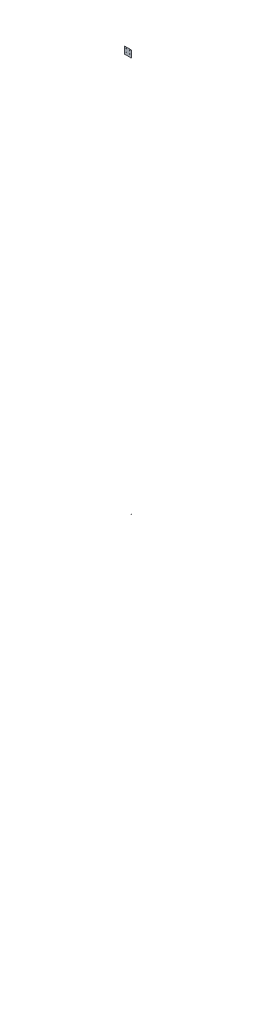
from build123d import *

# Parameters (mm, degrees)
SCHIZZO1_W                     = 448
SCHIZZO1_H                     = 448
SCHIZZO1_R                     = 4
ESTRUSIONE_ESTRUSIONE1_DEPTH   = 3
ESTRUSIONE_ESTRUSIONE1_2_DEPTH = 3
ESTRUSIONE_ESTRUSIONE1_3_DEPTH = 3
ESTRUSIONE_ESTRUSIONE1_4_DEPTH = 3
ESTRUSIONE_ESTRUSIONE1_5_DEPTH = 3
ESTRUSIONE_ESTRUSIONE1_6_DEPTH = 3
ESTRUSIONE_ESTRUSIONE1_7_DEPTH = 3
ESTRUSIONE_ESTRUSIONE1_8_DEPTH = 3
ESTRUSIONE_ESTRUSIONE1_9_DEPTH = 3


with BuildPart() as part:
    # Schizzo1 → Estrusione-Estrusione1 (new body)
    with BuildSketch(Plane.XY):
        with Locations((224, 224)):
            Rectangle(SCHIZZO1_W, SCHIZZO1_H)
        with Locations((335.970716632, 416)):
            Circle(SCHIZZO1_R, mode=Mode.SUBTRACT)
        with Locations((335.970716632, 384)):
            Circle(SCHIZZO1_R, mode=Mode.SUBTRACT)
        with Locations((335.970716632, 352)):
            Circle(SCHIZZO1_R, mode=Mode.SUBTRACT)
        with Locations((335.970716632, 320)):
            Circle(SCHIZZO1_R, mode=Mode.SUBTRACT)
        with Locations((335.970716632, 288)):
            Circle(SCHIZZO1_R, mode=Mode.SUBTRACT)
        with Locations((335.970716632, 256)):
            Circle(SCHIZZO1_R, mode=Mode.SUBTRACT)
        with Locations((335.970716632, 224)):
            Circle(SCHIZZO1_R, mode=Mode.SUBTRACT)
        with Locations((335.970716632, 192)):
            Circle(SCHIZZO1_R, mode=Mode.SUBTRACT)
        with Locations((335.970716632, 160)):
            Circle(SCHIZZO1_R, mode=Mode.SUBTRACT)
        with Locations((335.970716632, 128)):
            Circle(SCHIZZO1_R, mode=Mode.SUBTRACT)
        with Locations((335.970716632, 96)):
            Circle(SCHIZZO1_R, mode=Mode.SUBTRACT)
        with Locations((335.970716632, 64)):
            Circle(SCHIZZO1_R, mode=Mode.SUBTRACT)
        with Locations((335.970716632, 32)):
            Circle(SCHIZZO1_R, mode=Mode.SUBTRACT)
        with Locations((112.029283368, 32)):
            Circle(SCHIZZO1_R, mode=Mode.SUBTRACT)
        with Locations((112.029283368, 64)):
            Circle(SCHIZZO1_R, mode=Mode.SUBTRACT)
        with Locations((112.029283368, 96)):
            Circle(SCHIZZO1_R, mode=Mode.SUBTRACT)
        with Locations((112.029283368, 128)):
            Circle(SCHIZZO1_R, mode=Mode.SUBTRACT)
        with Locations((112.029283368, 160)):
            Circle(SCHIZZO1_R, mode=Mode.SUBTRACT)
        with Locations((112.029283368, 192)):
            Circle(SCHIZZO1_R, mode=Mode.SUBTRACT)
        with Locations((112.029283368, 224)):
            Circle(SCHIZZO1_R, mode=Mode.SUBTRACT)
        with Locations((112.029283368, 256)):
            Circle(SCHIZZO1_R, mode=Mode.SUBTRACT)
        with Locations((112.029283368, 288)):
            Circle(SCHIZZO1_R, mode=Mode.SUBTRACT)
        with Locations((112.029283368, 320)):
            Circle(SCHIZZO1_R, mode=Mode.SUBTRACT)
        with Locations((112.029283368, 352)):
            Circle(SCHIZZO1_R, mode=Mode.SUBTRACT)
        with Locations((112.029283368, 384)):
            Circle(SCHIZZO1_R, mode=Mode.SUBTRACT)
        with Locations((112.029283368, 416)):
            Circle(SCHIZZO1_R, mode=Mode.SUBTRACT)
        with BuildLine():
            Line((9, 338), (11, 338))
            ThreePointArc((11, 338), (13, 336), (11, 334))
            Line((11, 334), (9, 334))
            ThreePointArc((9, 334), (7, 336), (9, 338))
        make_face(mode=Mode.SUBTRACT)
        with BuildLine():
            Line((9, 110), (11, 110))
            ThreePointArc((11, 110), (13, 112), (11, 114))
            Line((11, 114), (9, 114))
            ThreePointArc((9, 114), (7, 112), (9, 110))
        make_face(mode=Mode.SUBTRACT)
        with BuildLine():
            Line((439, 110), (437, 110))
            ThreePointArc((437, 110), (435, 112), (437, 114))
            Line((437, 114), (439, 114))
            ThreePointArc((439, 114), (441, 112), (439, 110))
        make_face(mode=Mode.SUBTRACT)
        with BuildLine():
            Line((439, 338), (437, 338))
            ThreePointArc((437, 338), (435, 336), (437, 334))
            Line((437, 334), (439, 334))
            ThreePointArc((439, 334), (441, 336), (439, 338))
        make_face(mode=Mode.SUBTRACT)
        with BuildLine():
            Line((114, 439), (114, 437))
            ThreePointArc((114, 437), (112, 435), (110, 437))
            Line((110, 437), (110, 439))
            ThreePointArc((110, 439), (112, 441), (114, 439))
        make_face(mode=Mode.SUBTRACT)
        with BuildLine():
            Line((334, 439), (334, 437))
            ThreePointArc((334, 437), (336, 435), (338, 437))
            Line((338, 437), (338, 439))
            ThreePointArc((338, 439), (336, 441), (334, 439))
        make_face(mode=Mode.SUBTRACT)
        with BuildLine():
            Line((114, 9), (114, 11))
            ThreePointArc((114, 11), (112, 13), (110, 11))
            Line((110, 11), (110, 9))
            ThreePointArc((110, 9), (112, 7), (114, 9))
        make_face(mode=Mode.SUBTRACT)
        with BuildLine():
            Line((334, 9), (334, 11))
            ThreePointArc((334, 11), (336, 13), (338, 11))
            Line((338, 11), (338, 9))
            ThreePointArc((338, 9), (336, 7), (334, 9))
        make_face(mode=Mode.SUBTRACT)
        with BuildLine():
            Line((34.958788995, 265.366145204), (34.958788995, 309.366145204))
            ThreePointArc((34.958788995, 309.366145204), (36.958788995, 311.366145204), (38.958788995, 309.366145204))
            Line((38.958788995, 309.366145204), (38.958788995, 265.366145204))
            ThreePointArc((38.958788995, 265.366145204), (36.958788995, 263.366145204), (34.958788995, 265.366145204))
        make_face(mode=Mode.SUBTRACT)
        with BuildLine():
            Line((34.958788995, 182.633854796), (34.958788995, 138.633854796))
            ThreePointArc((34.958788995, 138.633854796), (36.958788995, 136.633854796), (38.958788995, 138.633854796))
            Line((38.958788995, 138.633854796), (38.958788995, 182.633854796))
            ThreePointArc((38.958788995, 182.633854796), (36.958788995, 184.633854796), (34.958788995, 182.633854796))
        make_face(mode=Mode.SUBTRACT)
        with BuildLine():
            Line((35.086959829, 204.138830615), (35.086959829, 244.138830615))
            ThreePointArc((35.086959829, 244.138830615), (37.086959829, 246.138830615), (39.086959829, 244.138830615))
            Line((39.086959829, 244.138830615), (39.086959829, 204.138830615))
            ThreePointArc((39.086959829, 204.138830615), (37.086959829, 202.138830615), (35.086959829, 204.138830615))
        make_face(mode=Mode.SUBTRACT)
        with BuildLine():
            Line((189.041211005, 265.366145204), (189.041211005, 309.366145204))
            ThreePointArc((189.041211005, 309.366145204), (187.041211005, 311.366145204), (185.041211005, 309.366145204))
            Line((185.041211005, 309.366145204), (185.041211005, 265.366145204))
            ThreePointArc((185.041211005, 265.366145204), (187.041211005, 263.366145204), (189.041211005, 265.366145204))
        make_face(mode=Mode.SUBTRACT)
        with BuildLine():
            Line((188.913040171, 204.138830615), (188.913040171, 244.138830615))
            ThreePointArc((188.913040171, 244.138830615), (186.913040171, 246.138830615), (184.913040171, 244.138830615))
            Line((184.913040171, 244.138830615), (184.913040171, 204.138830615))
            ThreePointArc((184.913040171, 204.138830615), (186.913040171, 202.138830615), (188.913040171, 204.138830615))
        make_face(mode=Mode.SUBTRACT)
        with BuildLine():
            Line((189.041211005, 182.633854796), (189.041211005, 138.633854796))
            ThreePointArc((189.041211005, 138.633854796), (187.041211005, 136.633854796), (185.041211005, 138.633854796))
            Line((185.041211005, 138.633854796), (185.041211005, 182.633854796))
            ThreePointArc((185.041211005, 182.633854796), (187.041211005, 184.633854796), (189.041211005, 182.633854796))
        make_face(mode=Mode.SUBTRACT)
        with BuildLine():
            Line((243.970716252, 418), (263.970716252, 418))
            ThreePointArc((263.970716252, 418), (265.970716252, 416), (263.970716252, 414))
            Line((263.970716252, 414), (243.970716252, 414))
            ThreePointArc((243.970716252, 414), (241.970716252, 416), (243.970716252, 418))
        make_face(mode=Mode.SUBTRACT)
        with BuildLine():
            Line((427.970329998, 418.017724106), (407.970330369, 418.013871032))
            ThreePointArc((407.970330369, 418.013871032), (405.970715714, 416.013485761), (407.971100984, 414.013871106))
            Line((407.971100984, 414.013871106), (427.971100613, 414.017724181))
            ThreePointArc((427.971100613, 414.017724181), (429.970715268, 416.018109451), (427.970329998, 418.017724106))
        make_face(mode=Mode.SUBTRACT)
        with BuildLine():
            Line((243.970716252, 386), (263.970716252, 386))
            ThreePointArc((263.970716252, 386), (265.970716252, 384), (263.970716252, 382))
            Line((263.970716252, 382), (243.970716252, 382))
            ThreePointArc((243.970716252, 382), (241.970716252, 384), (243.970716252, 386))
        make_face(mode=Mode.SUBTRACT)
        with BuildLine():
            Line((427.970329998, 386.017724106), (407.970330369, 386.013871032))
            ThreePointArc((407.970330369, 386.013871032), (405.970715714, 384.013485761), (407.971100984, 382.013871106))
            Line((407.971100984, 382.013871106), (427.971100613, 382.017724181))
            ThreePointArc((427.971100613, 382.017724181), (429.970715268, 384.018109451), (427.970329998, 386.017724106))
        make_face(mode=Mode.SUBTRACT)
        with BuildLine():
            Line((277.872450261, 383.004982615), (277.872450261, 412.995017385))
            ThreePointArc((277.872450261, 412.995017385), (279.972450256, 415.09501738), (282.072450251, 412.995017385))
            Line((282.072450251, 412.995017385), (282.072450251, 383.004982615))
            ThreePointArc((282.072450251, 383.004982615), (279.972450256, 380.90498262), (277.872450261, 383.004982615))
        make_face(mode=Mode.SUBTRACT)
        with BuildLine():
            Line((243.970716252, 354), (263.970716252, 354))
            ThreePointArc((263.970716252, 354), (265.970716252, 352), (263.970716252, 350))
            Line((263.970716252, 350), (243.970716252, 350))
            ThreePointArc((243.970716252, 350), (241.970716252, 352), (243.970716252, 354))
        make_face(mode=Mode.SUBTRACT)
        with BuildLine():
            Line((427.970329998, 354.017724106), (407.970330369, 354.013871032))
            ThreePointArc((407.970330369, 354.013871032), (405.970715714, 352.013485761), (407.971100984, 350.013871106))
            Line((407.971100984, 350.013871106), (427.971100613, 350.017724181))
            ThreePointArc((427.971100613, 350.017724181), (429.970715268, 352.018109451), (427.970329998, 354.017724106))
        make_face(mode=Mode.SUBTRACT)
        with BuildLine():
            Line((243.970716252, 322), (263.970716252, 322))
            ThreePointArc((263.970716252, 322), (265.970716252, 320), (263.970716252, 318))
            Line((263.970716252, 318), (243.970716252, 318))
            ThreePointArc((243.970716252, 318), (241.970716252, 320), (243.970716252, 322))
        make_face(mode=Mode.SUBTRACT)
        with BuildLine():
            Line((427.970329998, 322.017724106), (407.970330369, 322.013871032))
            ThreePointArc((407.970330369, 322.013871032), (405.970715714, 320.013485761), (407.971100984, 318.013871106))
            Line((407.971100984, 318.013871106), (427.971100613, 318.017724181))
            ThreePointArc((427.971100613, 318.017724181), (429.970715268, 320.018109451), (427.970329998, 322.017724106))
        make_face(mode=Mode.SUBTRACT)
        with BuildLine():
            Line((394.072449736, 383.005806193), (394.072449736, 413.015771025))
            ThreePointArc((394.072449736, 413.015771025), (391.972449736, 415.115771025), (389.872449736, 413.015771025))
            Line((389.872449736, 413.015771025), (389.872449736, 383.005806193))
            ThreePointArc((389.872449736, 383.005806193), (391.972449736, 380.905806193), (394.072449736, 383.005806193))
        make_face(mode=Mode.SUBTRACT)
        with BuildLine():
            Line((243.970716252, 290), (263.970716252, 290))
            ThreePointArc((263.970716252, 290), (265.970716252, 288), (263.970716252, 286))
            Line((263.970716252, 286), (243.970716252, 286))
            ThreePointArc((243.970716252, 286), (241.970716252, 288), (243.970716252, 290))
        make_face(mode=Mode.SUBTRACT)
        with BuildLine():
            Line((427.970329998, 290.017724106), (407.970330369, 290.013871032))
            ThreePointArc((407.970330369, 290.013871032), (405.970715714, 288.013485761), (407.971100984, 286.013871106))
            Line((407.971100984, 286.013871106), (427.971100613, 286.017724181))
            ThreePointArc((427.971100613, 286.017724181), (429.970715268, 288.018109451), (427.970329998, 290.017724106))
        make_face(mode=Mode.SUBTRACT)
        with BuildLine():
            Line((243.970716252, 258), (263.970716252, 258))
            ThreePointArc((263.970716252, 258), (265.970716252, 256), (263.970716252, 254))
            Line((263.970716252, 254), (243.970716252, 254))
            ThreePointArc((243.970716252, 254), (241.970716252, 256), (243.970716252, 258))
        make_face(mode=Mode.SUBTRACT)
        with BuildLine():
            Line((427.970329998, 258.017724106), (407.970330369, 258.013871032))
            ThreePointArc((407.970330369, 258.013871032), (405.970715714, 256.013485761), (407.971100984, 254.013871106))
            Line((407.971100984, 254.013871106), (427.971100613, 254.017724181))
            ThreePointArc((427.971100613, 254.017724181), (429.970715268, 256.018109451), (427.970329998, 258.017724106))
        make_face(mode=Mode.SUBTRACT)
        with BuildLine():
            Line((243.970716252, 226), (263.970716252, 226))
            ThreePointArc((263.970716252, 226), (265.970716252, 224), (263.970716252, 222))
            Line((263.970716252, 222), (243.970716252, 222))
            ThreePointArc((243.970716252, 222), (241.970716252, 224), (243.970716252, 226))
        make_face(mode=Mode.SUBTRACT)
        with BuildLine():
            Line((427.970329998, 226.017724106), (407.970330369, 226.013871032))
            ThreePointArc((407.970330369, 226.013871032), (405.970715714, 224.013485761), (407.971100984, 222.013871106))
            Line((407.971100984, 222.013871106), (427.971100613, 222.017724181))
            ThreePointArc((427.971100613, 222.017724181), (429.970715268, 224.018109451), (427.970329998, 226.017724106))
        make_face(mode=Mode.SUBTRACT)
        with BuildLine():
            Line((243.970716252, 194), (263.970716252, 194))
            ThreePointArc((263.970716252, 194), (265.970716252, 192), (263.970716252, 190))
            Line((263.970716252, 190), (243.970716252, 190))
            ThreePointArc((243.970716252, 190), (241.970716252, 192), (243.970716252, 194))
        make_face(mode=Mode.SUBTRACT)
        with BuildLine():
            Line((427.970329998, 194.017724106), (407.970330369, 194.013871032))
            ThreePointArc((407.970330369, 194.013871032), (405.970715714, 192.013485761), (407.971100984, 190.013871106))
            Line((407.971100984, 190.013871106), (427.971100613, 190.017724181))
            ThreePointArc((427.971100613, 190.017724181), (429.970715268, 192.018109451), (427.970329998, 194.017724106))
        make_face(mode=Mode.SUBTRACT)
        with BuildLine():
            Line((243.970716252, 162), (263.970716252, 162))
            ThreePointArc((263.970716252, 162), (265.970716252, 160), (263.970716252, 158))
            Line((263.970716252, 158), (243.970716252, 158))
            ThreePointArc((243.970716252, 158), (241.970716252, 160), (243.970716252, 162))
        make_face(mode=Mode.SUBTRACT)
        with BuildLine():
            Line((427.970329998, 162.017724106), (407.970330369, 162.013871032))
            ThreePointArc((407.970330369, 162.013871032), (405.970715714, 160.013485761), (407.971100984, 158.013871106))
            Line((407.971100984, 158.013871106), (427.971100613, 158.017724181))
            ThreePointArc((427.971100613, 158.017724181), (429.970715268, 160.018109451), (427.970329998, 162.017724106))
        make_face(mode=Mode.SUBTRACT)
        with BuildLine():
            Line((243.970716252, 130), (263.970716252, 130))
            ThreePointArc((263.970716252, 130), (265.970716252, 128), (263.970716252, 126))
            Line((263.970716252, 126), (243.970716252, 126))
            ThreePointArc((243.970716252, 126), (241.970716252, 128), (243.970716252, 130))
        make_face(mode=Mode.SUBTRACT)
        with BuildLine():
            Line((427.970329998, 130.017724106), (407.970330369, 130.013871032))
            ThreePointArc((407.970330369, 130.013871032), (405.970715714, 128.013485761), (407.971100984, 126.013871106))
            Line((407.971100984, 126.013871106), (427.971100613, 126.017724181))
            ThreePointArc((427.971100613, 126.017724181), (429.970715268, 128.018109451), (427.970329998, 130.017724106))
        make_face(mode=Mode.SUBTRACT)
        with BuildLine():
            Line((277.872450261, 333.004982615), (277.872450261, 362.995017385))
            ThreePointArc((277.872450261, 362.995017385), (279.972450256, 365.09501738), (282.072450251, 362.995017385))
            Line((282.072450251, 362.995017385), (282.072450251, 333.004982615))
            ThreePointArc((282.072450251, 333.004982615), (279.972450256, 330.90498262), (277.872450261, 333.004982615))
        make_face(mode=Mode.SUBTRACT)
        with BuildLine():
            Line((394.072449736, 333.005806193), (394.072449736, 363.015771025))
            ThreePointArc((394.072449736, 363.015771025), (391.972449736, 365.115771025), (389.872449736, 363.015771025))
            Line((389.872449736, 363.015771025), (389.872449736, 333.005806193))
            ThreePointArc((389.872449736, 333.005806193), (391.972449736, 330.905806193), (394.072449736, 333.005806193))
        make_face(mode=Mode.SUBTRACT)
        with BuildLine():
            Line((277.872450261, 283.004982615), (277.872450261, 312.995017385))
            ThreePointArc((277.872450261, 312.995017385), (279.972450256, 315.09501738), (282.072450251, 312.995017385))
            Line((282.072450251, 312.995017385), (282.072450251, 283.004982615))
            ThreePointArc((282.072450251, 283.004982615), (279.972450256, 280.90498262), (277.872450261, 283.004982615))
        make_face(mode=Mode.SUBTRACT)
        with BuildLine():
            Line((394.072449736, 283.005806193), (394.072449736, 313.015771025))
            ThreePointArc((394.072449736, 313.015771025), (391.972449736, 315.115771025), (389.872449736, 313.015771025))
            Line((389.872449736, 313.015771025), (389.872449736, 283.005806193))
            ThreePointArc((389.872449736, 283.005806193), (391.972449736, 280.905806193), (394.072449736, 283.005806193))
        make_face(mode=Mode.SUBTRACT)
        with BuildLine():
            Line((277.872450261, 233.004982615), (277.872450261, 262.995017385))
            ThreePointArc((277.872450261, 262.995017385), (279.972450256, 265.09501738), (282.072450251, 262.995017385))
            Line((282.072450251, 262.995017385), (282.072450251, 233.004982615))
            ThreePointArc((282.072450251, 233.004982615), (279.972450256, 230.90498262), (277.872450261, 233.004982615))
        make_face(mode=Mode.SUBTRACT)
        with BuildLine():
            Line((394.072449736, 233.005806193), (394.072449736, 263.015771025))
            ThreePointArc((394.072449736, 263.015771025), (391.972449736, 265.115771025), (389.872449736, 263.015771025))
            Line((389.872449736, 263.015771025), (389.872449736, 233.005806193))
            ThreePointArc((389.872449736, 233.005806193), (391.972449736, 230.905806193), (394.072449736, 233.005806193))
        make_face(mode=Mode.SUBTRACT)
        with BuildLine():
            Line((277.872450261, 183.004982615), (277.872450261, 212.995017385))
            ThreePointArc((277.872450261, 212.995017385), (279.972450256, 215.09501738), (282.072450251, 212.995017385))
            Line((282.072450251, 212.995017385), (282.072450251, 183.004982615))
            ThreePointArc((282.072450251, 183.004982615), (279.972450256, 180.90498262), (277.872450261, 183.004982615))
        make_face(mode=Mode.SUBTRACT)
        with BuildLine():
            Line((394.072449736, 183.005806193), (394.072449736, 213.015771025))
            ThreePointArc((394.072449736, 213.015771025), (391.972449736, 215.115771025), (389.872449736, 213.015771025))
            Line((389.872449736, 213.015771025), (389.872449736, 183.005806193))
            ThreePointArc((389.872449736, 183.005806193), (391.972449736, 180.905806193), (394.072449736, 183.005806193))
        make_face(mode=Mode.SUBTRACT)
        with BuildLine():
            Line((277.872450261, 133.004982615), (277.872450261, 162.995017385))
            ThreePointArc((277.872450261, 162.995017385), (279.972450256, 165.09501738), (282.072450251, 162.995017385))
            Line((282.072450251, 162.995017385), (282.072450251, 133.004982615))
            ThreePointArc((282.072450251, 133.004982615), (279.972450256, 130.90498262), (277.872450261, 133.004982615))
        make_face(mode=Mode.SUBTRACT)
        with BuildLine():
            Line((394.072449736, 133.005806193), (394.072449736, 163.015771025))
            ThreePointArc((394.072449736, 163.015771025), (391.972449736, 165.115771025), (389.872449736, 163.015771025))
            Line((389.872449736, 163.015771025), (389.872449736, 133.005806193))
            ThreePointArc((389.872449736, 133.005806193), (391.972449736, 130.905806193), (394.072449736, 133.005806193))
        make_face(mode=Mode.SUBTRACT)
        with BuildLine():
            Line((277.872450261, 83.004982615), (277.872450261, 112.995017385))
            ThreePointArc((277.872450261, 112.995017385), (279.972450256, 115.09501738), (282.072450251, 112.995017385))
            Line((282.072450251, 112.995017385), (282.072450251, 83.004982615))
            ThreePointArc((282.072450251, 83.004982615), (279.972450256, 80.90498262), (277.872450261, 83.004982615))
        make_face(mode=Mode.SUBTRACT)
        with BuildLine():
            Line((394.072449736, 83.005806193), (394.072449736, 113.015771025))
            ThreePointArc((394.072449736, 113.015771025), (391.972449736, 115.115771025), (389.872449736, 113.015771025))
            Line((389.872449736, 113.015771025), (389.872449736, 83.005806193))
            ThreePointArc((389.872449736, 83.005806193), (391.972449736, 80.905806193), (394.072449736, 83.005806193))
        make_face(mode=Mode.SUBTRACT)
        with BuildLine():
            Line((243.970716252, 98), (263.970716252, 98))
            ThreePointArc((263.970716252, 98), (265.970716252, 96), (263.970716252, 94))
            Line((263.970716252, 94), (243.970716252, 94))
            ThreePointArc((243.970716252, 94), (241.970716252, 96), (243.970716252, 98))
        make_face(mode=Mode.SUBTRACT)
        with BuildLine():
            Line((427.970329998, 98.017724106), (407.970330369, 98.013871032))
            ThreePointArc((407.970330369, 98.013871032), (405.970715714, 96.013485761), (407.971100984, 94.013871106))
            Line((407.971100984, 94.013871106), (427.971100613, 94.017724181))
            ThreePointArc((427.971100613, 94.017724181), (429.970715268, 96.018109451), (427.970329998, 98.017724106))
        make_face(mode=Mode.SUBTRACT)
        with BuildLine():
            Line((243.970716252, 66), (263.970716252, 66))
            ThreePointArc((263.970716252, 66), (265.970716252, 64), (263.970716252, 62))
            Line((263.970716252, 62), (243.970716252, 62))
            ThreePointArc((243.970716252, 62), (241.970716252, 64), (243.970716252, 66))
        make_face(mode=Mode.SUBTRACT)
        with BuildLine():
            Line((427.970329998, 66.017724106), (407.970330369, 66.013871032))
            ThreePointArc((407.970330369, 66.013871032), (405.970715714, 64.013485761), (407.971100984, 62.013871106))
            Line((407.971100984, 62.013871106), (427.971100613, 62.017724181))
            ThreePointArc((427.971100613, 62.017724181), (429.970715268, 64.018109451), (427.970329998, 66.017724106))
        make_face(mode=Mode.SUBTRACT)
        with BuildLine():
            Line((243.970716252, 34), (263.970716252, 34))
            ThreePointArc((263.970716252, 34), (265.970716252, 32), (263.970716252, 30))
            Line((263.970716252, 30), (243.970716252, 30))
            ThreePointArc((243.970716252, 30), (241.970716252, 32), (243.970716252, 34))
        make_face(mode=Mode.SUBTRACT)
        with BuildLine():
            Line((427.970329998, 34.017724106), (407.970330369, 34.013871032))
            ThreePointArc((407.970330369, 34.013871032), (405.970715714, 32.013485761), (407.971100984, 30.013871106))
            Line((407.971100984, 30.013871106), (427.971100613, 30.017724181))
            ThreePointArc((427.971100613, 30.017724181), (429.970715268, 32.018109451), (427.970329998, 34.017724106))
        make_face(mode=Mode.SUBTRACT)
    extrude(amount=-ESTRUSIONE_ESTRUSIONE1_DEPTH)


with BuildPart() as body_2:
    # Schizzo1 → Estrusione-Estrusione1 2 (new body)
    with BuildSketch(Plane.XY):
        with BuildLine():
            Line((243.970716252, -12406.673813487), (263.970716252, -12406.673813487))
            ThreePointArc((263.970716252, -12406.673813487), (265.970716252, -12408.673813487), (263.970716252, -12410.673813487))
            Line((263.970716252, -12410.673813487), (243.970716252, -12410.673813487))
            ThreePointArc((243.970716252, -12410.673813487), (241.970716252, -12408.673813487), (243.970716252, -12406.673813487))
        make_face()
    extrude(amount=-ESTRUSIONE_ESTRUSIONE1_2_DEPTH)


with BuildPart() as body_3:
    # Schizzo1 → Estrusione-Estrusione1 3 (new body)
    with BuildSketch(Plane.XY):
        with BuildLine():
            Line((243.970716252, -25231.347626974), (263.970716252, -25231.347626974))
            ThreePointArc((263.970716252, -25231.347626974), (265.970716252, -25233.347626974), (263.970716252, -25235.347626974))
            Line((263.970716252, -25235.347626974), (243.970716252, -25235.347626974))
            ThreePointArc((243.970716252, -25235.347626974), (241.970716252, -25233.347626974), (243.970716252, -25231.347626974))
        make_face()
    extrude(amount=-ESTRUSIONE_ESTRUSIONE1_3_DEPTH)


with BuildPart() as body_4:
    # Schizzo1 → Estrusione-Estrusione1 4 (new body)
    with BuildSketch(Plane.XY):
        with BuildLine():
            Line((243.970716252, -38056.02144046), (263.970716252, -38056.02144046))
            ThreePointArc((263.970716252, -38056.02144046), (265.970716252, -38058.02144046), (263.970716252, -38060.02144046))
            Line((263.970716252, -38060.02144046), (243.970716252, -38060.02144046))
            ThreePointArc((243.970716252, -38060.02144046), (241.970716252, -38058.02144046), (243.970716252, -38056.02144046))
        make_face()
    extrude(amount=-ESTRUSIONE_ESTRUSIONE1_4_DEPTH)


with BuildPart() as body_5:
    # Schizzo1 → Estrusione-Estrusione1 5 (new body)
    with BuildSketch(Plane.XY):
        with BuildLine():
            Line((243.970716252, -50880.695253947), (263.970716252, -50880.695253947))
            ThreePointArc((263.970716252, -50880.695253947), (265.970716252, -50882.695253947), (263.970716252, -50884.695253947))
            Line((263.970716252, -50884.695253947), (243.970716252, -50884.695253947))
            ThreePointArc((243.970716252, -50884.695253947), (241.970716252, -50882.695253947), (243.970716252, -50880.695253947))
        make_face()
    extrude(amount=-ESTRUSIONE_ESTRUSIONE1_5_DEPTH)


with BuildPart() as body_6:
    # Schizzo1 → Estrusione-Estrusione1 6 (new body)
    with BuildSketch(Plane.XY):
        with BuildLine():
            Line((437.853215143, -50880.676577853), (417.853215514, -50880.680430928))
            ThreePointArc((417.853215514, -50880.680430928), (415.853600859, -50882.680816198), (417.853986129, -50884.680430854))
            Line((417.853986129, -50884.680430854), (437.853985758, -50884.676577779))
            ThreePointArc((437.853985758, -50884.676577779), (439.853600413, -50882.676192509), (437.853215143, -50880.676577853))
        make_face()
    extrude(amount=-ESTRUSIONE_ESTRUSIONE1_6_DEPTH)


with BuildPart() as body_7:
    # Schizzo1 → Estrusione-Estrusione1 7 (new body)
    with BuildSketch(Plane.XY):
        with BuildLine():
            Line((435.382493857, -38056.003002363), (415.382494228, -38056.006855438))
            ThreePointArc((415.382494228, -38056.006855438), (413.382879573, -38058.007240708), (415.383264843, -38060.006855364))
            Line((415.383264843, -38060.006855364), (435.383264472, -38060.003002289))
            ThreePointArc((435.383264472, -38060.003002289), (437.382879127, -38058.002617019), (435.382493857, -38056.003002363))
        make_face()
    extrude(amount=-ESTRUSIONE_ESTRUSIONE1_7_DEPTH)


with BuildPart() as body_8:
    # Schizzo1 → Estrusione-Estrusione1 8 (new body)
    with BuildSketch(Plane.XY):
        with BuildLine():
            Line((432.911772571, -25231.329426873), (412.911772942, -25231.333279948))
            ThreePointArc((412.911772942, -25231.333279948), (410.912158286, -25233.333665218), (412.912543557, -25235.333279874))
            Line((412.912543557, -25235.333279874), (432.912543185, -25235.329426799))
            ThreePointArc((432.912543185, -25235.329426799), (434.912157841, -25233.329041529), (432.911772571, -25231.329426873))
        make_face()
    extrude(amount=-ESTRUSIONE_ESTRUSIONE1_8_DEPTH)


with BuildPart() as body_9:
    # Schizzo1 → Estrusione-Estrusione1 9 (new body)
    with BuildSketch(Plane.XY):
        with BuildLine():
            Line((430.441051284, -12406.655851384), (410.441051655, -12406.659704458))
            ThreePointArc((410.441051655, -12406.659704458), (408.441437, -12408.660089729), (410.44182227, -12410.659704384))
            Line((410.44182227, -12410.659704384), (430.441821899, -12410.655851309))
            ThreePointArc((430.441821899, -12410.655851309), (432.441436555, -12408.655466039), (430.441051284, -12406.655851384))
        make_face()
    extrude(amount=-ESTRUSIONE_ESTRUSIONE1_9_DEPTH)


solid = Compound([part.part, body_2.part, body_3.part, body_4.part, body_5.part, body_6.part, body_7.part, body_8.part, body_9.part])
